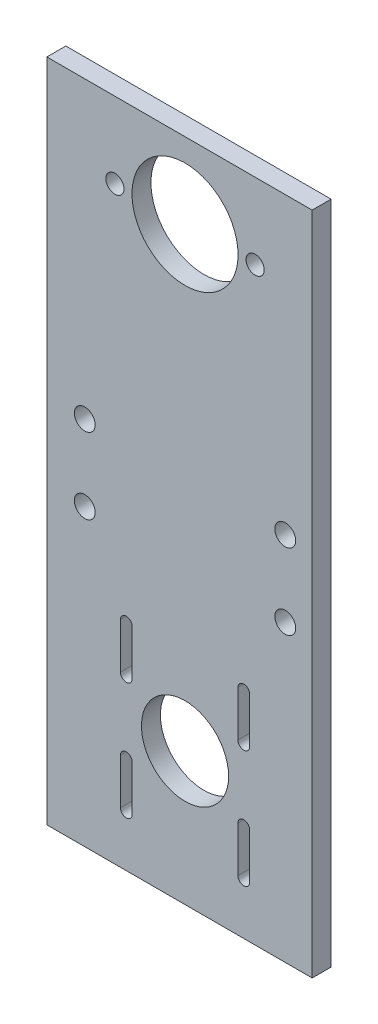
from build123d import *

# Parameters (mm, degrees)
SKETCH1_W           = 70
SKETCH1_H           = 175.49359262
SKETCH1_R           = 2.75
SKETCH1_R_2         = 11.5
SKETCH1_R_3         = 2.4
SKETCH1_R_4         = 14
BOSS_EXTRUDE1_DEPTH = 5


with BuildPart() as part:
    # Sketch1 → Boss-Extrude1 (new body)
    with BuildSketch(Plane.XY):
        with Locations((-1.450472168, 0)):
            Rectangle(SKETCH1_W, SKETCH1_H)
        with BuildLine():
            ThreePointArc((-17.05, -62.143427874), (-15.5, -60.593427874), (-13.95, -62.143427874))
            Line((-13.95, -62.143427874), (-13.95, -74.143427874))
            ThreePointArc((-13.95, -74.143427874), (-15.5, -75.693427874), (-17.05, -74.143427874))
            Line((-17.05, -74.143427874), (-17.05, -62.143427874))
        make_face(mode=Mode.SUBTRACT)
        with Locations((-26.450472168, -10)):
            Circle(SKETCH1_R, mode=Mode.SUBTRACT)
        with BuildLine():
            ThreePointArc((-17.05, -31.143427874), (-15.5, -29.593427874), (-13.95, -31.143427874))
            Line((-13.95, -31.143427874), (-13.95, -43.143427874))
            ThreePointArc((-13.95, -43.143427874), (-15.5, -44.693427874), (-17.05, -43.143427874))
            Line((-17.05, -43.143427874), (-17.05, -31.143427874))
        make_face(mode=Mode.SUBTRACT)
        with BuildLine():
            ThreePointArc((13.95, -62.143427874), (15.5, -60.593427874), (17.05, -62.143427874))
            Line((17.05, -62.143427874), (17.05, -74.143427874))
            ThreePointArc((17.05, -74.143427874), (15.5, -75.693427874), (13.95, -74.143427874))
            Line((13.95, -74.143427874), (13.95, -62.143427874))
        make_face(mode=Mode.SUBTRACT)
        with Locations((0, -52.643427874)):
            Circle(SKETCH1_R_2, mode=Mode.SUBTRACT)
        with BuildLine():
            ThreePointArc((13.95, -31.143427874), (15.5, -29.593427874), (17.05, -31.143427874))
            Line((17.05, -31.143427874), (17.05, -43.143427874))
            ThreePointArc((17.05, -43.143427874), (15.5, -44.693427874), (13.95, -43.143427874))
            Line((13.95, -43.143427874), (13.95, -31.143427874))
        make_face(mode=Mode.SUBTRACT)
        with Locations((26.450472168, -10)):
            Circle(SKETCH1_R, mode=Mode.SUBTRACT)
        with Locations((-26.450472168, 10)):
            Circle(SKETCH1_R, mode=Mode.SUBTRACT)
        with Locations((-18.5, 67.74679631)):
            Circle(SKETCH1_R_3, mode=Mode.SUBTRACT)
        with Locations((26.450472168, 10)):
            Circle(SKETCH1_R, mode=Mode.SUBTRACT)
        with Locations((0, 67.74679631)):
            Circle(SKETCH1_R_4, mode=Mode.SUBTRACT)
        with Locations((18.5, 67.74679631)):
            Circle(SKETCH1_R_3, mode=Mode.SUBTRACT)
    extrude(amount=BOSS_EXTRUDE1_DEPTH)


solid = part.part
